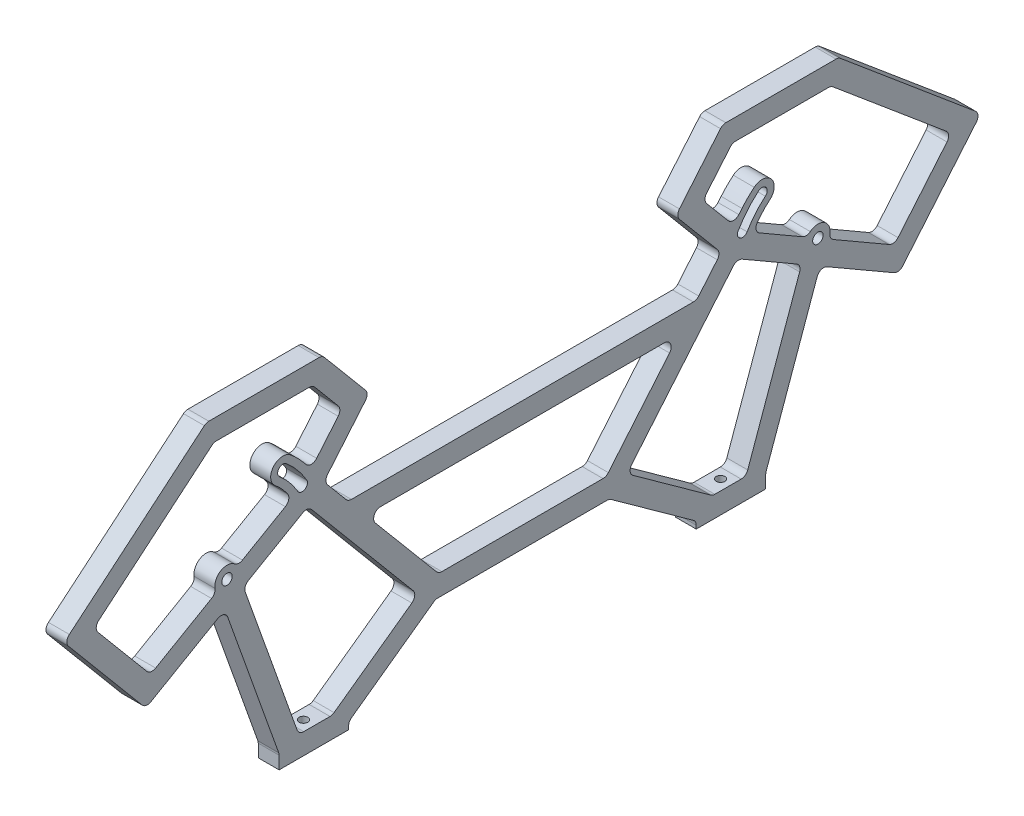
from build123d import *

# Parameters (mm, degrees)
SKETCH1_R            = 1.5
BOSS_EXTRUDE1_DEPTH  = 6
FILLET1_R            = 2
FILLET1_OF_MIRROR1_R = 2


with BuildPart() as part:
    # Sketch1 → Boss-Extrude1 (new body)
    with BuildSketch(Plane(origin=(0, 0, 0), x_dir=(0, 0, -1), z_dir=(1, 0, 0))):
        Polygon((50, 0), (70, 0), (70, 4), (85.592625509, 47.729644272), (108.344720621, 34.593716035), (131.887731685, 62.651184052), (90.952406878, 97), (57.582634621, 97), (44.086963265, 80.916485177), (57.141036159, 65.359246908), (50.126795161, 57), (0, 57), (0, 51), (45.092197374, 51), (24.114706595, 26), (0, 26), (0, 20), (25, 20), (50, 2), align=None)
        with Locations((85, 55)):
            Circle(SKETCH1_R, mode=Mode.SUBTRACT)
        Polygon((30.059592338, 23.750495981), (61.737302817, 61.50252125), (80.310098668, 50.779512566), (64.343122912, 6), (54.713058978, 6), align=None, mode=Mode.SUBTRACT)
        with BuildLine():
            Line((60.38048057, 91), (51.919407001, 80.916485177))
            Line((51.919407001, 80.916485177), (60.730906204, 70.415349346))
            Line((60.730906204, 70.415349346), (63.167733371, 73.319446876))
            ThreePointArc((63.167733371, 73.319446876), (64.847456736, 75.152543264), (66.680553124, 76.832266629))
            ThreePointArc((66.680553124, 76.832266629), (71.611465309, 76.400867712), (71.180066392, 71.469955527))
            ThreePointArc((71.180066392, 71.469955527), (68.530044473, 68.819933608), (66.380453819, 65.75))
            Line((66.380453819, 65.75), (81.968911087, 56.75))
            ThreePointArc((81.968911087, 56.75), (86.75, 58.031088913), (88.031088913, 53.25))
            Line((88.031088913, 53.25), (106.984631039, 42.307167351))
            Line((106.984631039, 42.307167351), (123.434739369, 61.911643051))
            Line((123.434739369, 61.911643051), (88.768585472, 91))
            Line((88.768585472, 91), (60.38048057, 91))
        make_face(mode=Mode.SUBTRACT)
        with BuildLine():
            ThreePointArc((67.966128343, 75.300177743), (64.699822257, 72.033871657), (62.0503268, 68.25))
            ThreePointArc((62.0503268, 68.25), (62.599364905, 66.200961894), (64.648403011, 66.75))
            ThreePointArc((64.648403011, 66.75), (66.997955587, 70.105508828), (69.894491172, 73.002044413))
            ThreePointArc((69.894491172, 73.002044413), (70.079376423, 75.115292493), (67.966128343, 75.300177743))
        make_face(mode=Mode.SUBTRACT)
    boss_extrude1 = extrude(amount=BOSS_EXTRUDE1_DEPTH)

    # Sketch2 → Tap Drill for M3 Tap1 (revolve, cut)
    with BuildSketch(Plane(origin=(3, 0, -60), x_dir=(0, 0, -1), z_dir=(1, 0, 0))):
        Polygon((0, 0), (0, 10.751075774), (1.25, 10), (1.25, 0), align=None)
    tap_drill_for_m3_tap1 = revolve(axis=Axis((3, -6.35, -60), (0, 1, 0)), mode=Mode.SUBTRACT)

    # Fillet1
    fillet1_edges = [part.edges().sort_by_distance(p)[0] for p in [
        (3, 65.75, -66.380453819),
        (3, 56.75, -81.968911087),
        (3, 53.25, -88.031088913),
        (3, 42.307167351, -106.984631039),
        (3, 61.911643051, -123.434739369),
        (3, 91, -88.768585472),
        (3, 91, -60.38048057),
        (3, 80.916485177, -51.919407001),
        (3, 70.415349346, -60.730906204),
        (3, 57, -50.126795161),
        (3, 80.916485177, -44.086963265),
        (3, 97, -57.582634621),
        (3, 97, -90.952406878),
        (3, 62.651184052, -131.887731685),
        (3, 34.593716035, -108.344720621),
        (3, 47.729644272, -85.592625509),
        (3, 4, -70),
        (3, 2, -50),
        (3, 20, -25),
        (3, 23.750495981, -30.059592338),
        (3, 6, -54.713058978),
        (3, 6, -64.343122912),
        (3, 50.779512566, -80.310098668),
        (3, 61.50252125, -61.737302817),
        (3, 26, -24.114706595),
        (3, 65.359246908, -57.141036159),
        (3, 51, -45.092197374),
    ]]
    fillet(fillet1_edges, radius=FILLET1_R)

    # Mirror1: Boss-Extrude1, Tap Drill for M3 Tap1 across plane
    add(boss_extrude1.mirror(Plane.XY))
    add(tap_drill_for_m3_tap1.mirror(Plane.XY), mode=Mode.SUBTRACT)

    # Fillet1 of Mirror1
    fillet1_of_mirror1_edges = [part.edges().sort_by_distance(p)[0] for p in [
        (3, 65.75, 66.380453819),
        (3, 56.75, 81.968911087),
        (3, 53.25, 88.031088913),
        (3, 42.307167351, 106.984631039),
        (3, 61.911643051, 123.434739369),
        (3, 91, 88.768585472),
        (3, 91, 60.38048057),
        (3, 80.916485177, 51.919407001),
        (3, 70.415349346, 60.730906204),
        (3, 57, 50.126795161),
        (3, 80.916485177, 44.086963265),
        (3, 97, 57.582634621),
        (3, 97, 90.952406878),
        (3, 62.651184052, 131.887731685),
        (3, 34.593716035, 108.344720621),
        (3, 47.729644272, 85.592625509),
        (3, 4, 70),
        (3, 2, 50),
        (3, 20, 25),
        (3, 23.750495981, 30.059592338),
        (3, 6, 54.713058978),
        (3, 6, 64.343122912),
        (3, 50.779512566, 80.310098668),
        (3, 61.50252125, 61.737302817),
        (3, 26, 24.114706595),
        (3, 65.359246908, 57.141036159),
        (3, 51, 45.092197374),
    ]]
    fillet(fillet1_of_mirror1_edges, radius=FILLET1_OF_MIRROR1_R)


solid = part.part
